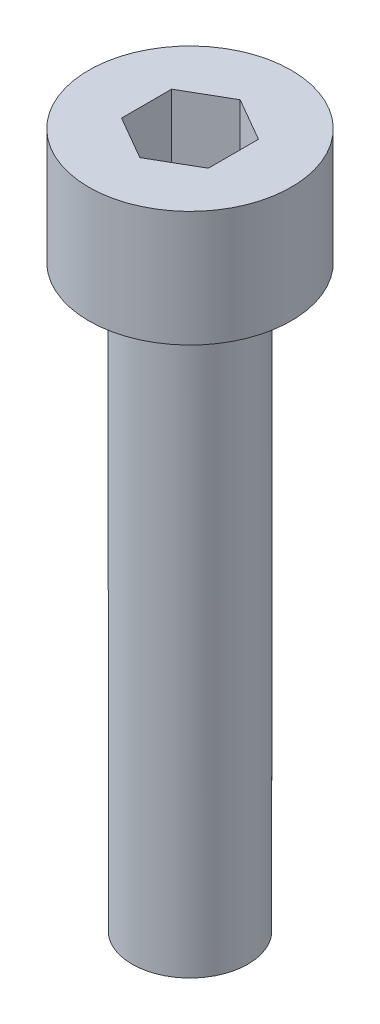
from build123d import *

# Parameters (mm, degrees)
SKETCH2_R           = 3.5
BOSS_EXTRUDE1_DEPTH = 4
SKETCH3_R           = 2
BOSS_EXTRUDE2_DEPTH = 20


with BuildPart() as part:
    # Sketch2 → Boss-Extrude1 (new body)
    with BuildSketch(Plane(origin=(0, 0, 0), x_dir=(1, 0, 0), z_dir=(0, 1, 0))):
        Circle(SKETCH2_R)
        Polygon((0, 1.732050808), (-1.5, 0.866025404), (-1.5, -0.866025404), (0, -1.732050808), (1.5, -0.866025404), (1.5, 0.866025404), align=None, mode=Mode.SUBTRACT)
    extrude(amount=BOSS_EXTRUDE1_DEPTH)

    # Sketch3 → Boss-Extrude2 (add)
    with BuildSketch(Plane.XZ):
        Circle(SKETCH3_R)
    extrude(amount=BOSS_EXTRUDE2_DEPTH)


solid = part.part
